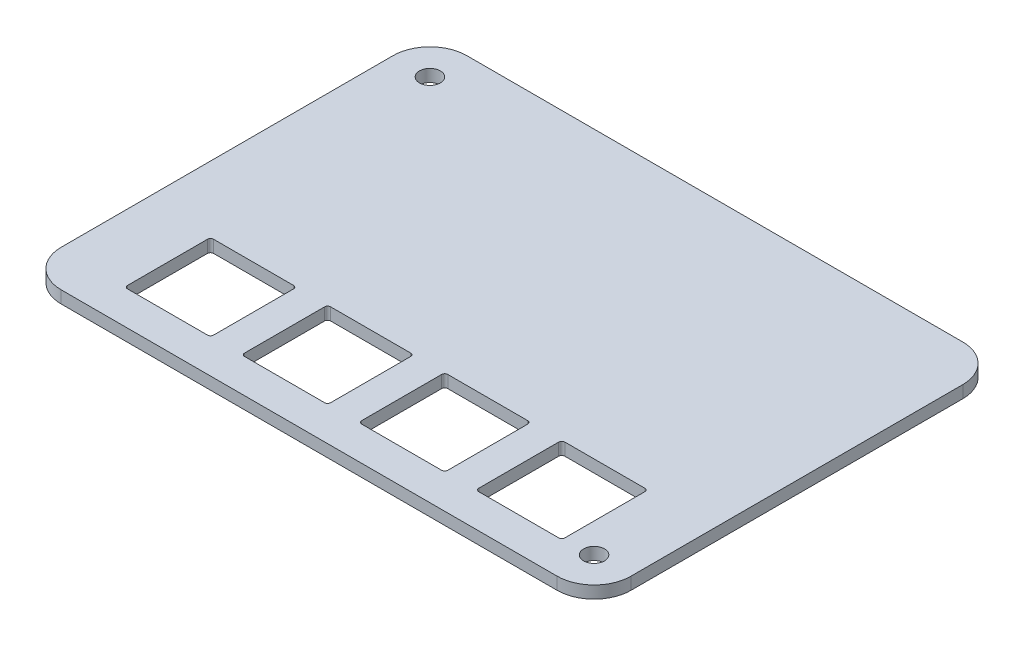
from build123d import *

# Parameters (mm, degrees)
SCHIZZO1_W                   = 92.702636
SCHIZZO1_H                   = 66
SCHIZZO1_W_2                 = 76.2
SCHIZZO1_H_2                 = 60
SCHIZZO1_H_3                 = 19.05
SCHIZZO1_H_4                 = 40.95
ESTRUSIONE_ESTRUSIONE1_DEPTH = 2
RACCORDO1_R                  = 6
FORO_PER_VITE_M3_1_D         = 3.4
FORO_PER_VITE_M3_1_DEPTH     = 13
FORO_PER_VITE_M3_1_TIP       = 1.021463052
TAGLIO_ESTRUSIONE1_DEPTH     = 1
ESTRUSIONE_ESTRUSIONE2_DEPTH = 1


with BuildPart() as part:
    # Schizzo1 → Estrusione-Estrusione1 (new body)
    # profile 1 of 3: a face of its own
    with BuildSketch(Plane(origin=(0, 0, 0), x_dir=(1, 0, 0), z_dir=(0, 1, 0))):
        with Locations((-38.1, 30)):
            Rectangle(SCHIZZO1_W, SCHIZZO1_H)
        with Locations((-38.1, 30)):
            Rectangle(SCHIZZO1_W_2, SCHIZZO1_H_2, mode=Mode.SUBTRACT)
    # profile 2 of 3: a face of its own
    with BuildSketch(Plane(origin=(0, 0, 0), x_dir=(1, 0, 0), z_dir=(0, 1, 0))):
        with Locations((-38.1, 9.525)):
            Rectangle(SCHIZZO1_W_2, SCHIZZO1_H_3)
        with BuildLine():
            ThreePointArc((-73.675, 16.025), (-73.528553391, 16.378553391), (-73.175, 16.525))
            Line((-73.175, 16.525), (-60.175, 16.525))
            ThreePointArc((-60.175, 16.525), (-59.821446609, 16.378553391), (-59.675, 16.025))
            Line((-59.675, 16.025), (-59.675, 3.025))
            ThreePointArc((-59.675, 3.025), (-59.821446609, 2.671446609), (-60.175, 2.525))
            Line((-60.175, 2.525), (-73.175, 2.525))
            ThreePointArc((-73.175, 2.525), (-73.528553391, 2.671446609), (-73.675, 3.025))
            Line((-73.675, 3.025), (-73.675, 16.025))
        make_face(mode=Mode.SUBTRACT)
        with BuildLine():
            ThreePointArc((-54.625, 16.025), (-54.478553391, 16.378553391), (-54.125, 16.525))
            Line((-54.125, 16.525), (-41.125, 16.525))
            ThreePointArc((-41.125, 16.525), (-40.771446609, 16.378553391), (-40.625, 16.025))
            Line((-40.625, 16.025), (-40.625, 3.025))
            ThreePointArc((-40.625, 3.025), (-40.771446609, 2.671446609), (-41.125, 2.525))
            Line((-41.125, 2.525), (-54.125, 2.525))
            ThreePointArc((-54.125, 2.525), (-54.478553391, 2.671446609), (-54.625, 3.025))
            Line((-54.625, 3.025), (-54.625, 16.025))
        make_face(mode=Mode.SUBTRACT)
        with BuildLine():
            ThreePointArc((-35.575, 16.025), (-35.428553391, 16.378553391), (-35.075, 16.525))
            Line((-35.075, 16.525), (-22.075, 16.525))
            ThreePointArc((-22.075, 16.525), (-21.721446609, 16.378553391), (-21.575, 16.025))
            Line((-21.575, 16.025), (-21.575, 3.025))
            ThreePointArc((-21.575, 3.025), (-21.721446609, 2.671446609), (-22.075, 2.525))
            Line((-22.075, 2.525), (-35.075, 2.525))
            ThreePointArc((-35.075, 2.525), (-35.428553391, 2.671446609), (-35.575, 3.025))
            Line((-35.575, 3.025), (-35.575, 16.025))
        make_face(mode=Mode.SUBTRACT)
        with BuildLine():
            ThreePointArc((-16.525, 16.025), (-16.378553391, 16.378553391), (-16.025, 16.525))
            Line((-16.025, 16.525), (-3.025, 16.525))
            ThreePointArc((-3.025, 16.525), (-2.671446609, 16.378553391), (-2.525, 16.025))
            Line((-2.525, 16.025), (-2.525, 3.025))
            ThreePointArc((-2.525, 3.025), (-2.671446609, 2.671446609), (-3.025, 2.525))
            Line((-3.025, 2.525), (-16.025, 2.525))
            ThreePointArc((-16.025, 2.525), (-16.378553391, 2.671446609), (-16.525, 3.025))
            Line((-16.525, 3.025), (-16.525, 16.025))
        make_face(mode=Mode.SUBTRACT)
    # profile 3 of 3: a face of its own
    with BuildSketch(Plane(origin=(0, 0, 0), x_dir=(1, 0, 0), z_dir=(0, 1, 0))):
        with Locations((-38.1, 39.525)):
            Rectangle(SCHIZZO1_W_2, SCHIZZO1_H_4)
    extrude(amount=ESTRUSIONE_ESTRUSIONE1_DEPTH)

    # Raccordo1
    raccordo1_edges = [part.edges().sort_by_distance(p)[0] for p in [
        (-84.451318, 1, -63),
        (8.251318, 1, -63),
        (8.251318, 1, 3),
        (-84.451318, 1, 3),
    ]]
    fillet(raccordo1_edges, radius=RACCORDO1_R)

    # Foro per Vite M3-1
    with Locations(Plane(origin=(0, 2, 0), x_dir=(1, 0, 0), z_dir=(0, 1, 0))):
        with Locations((-78.451318, 57), (2.251318, 3)):
            Hole(FORO_PER_VITE_M3_1_D / 2, depth=FORO_PER_VITE_M3_1_DEPTH)
            with Locations((0, 0, -(FORO_PER_VITE_M3_1_DEPTH + FORO_PER_VITE_M3_1_TIP / 2))):  # 118° drill point
                Cone(0, FORO_PER_VITE_M3_1_D / 2, FORO_PER_VITE_M3_1_TIP, mode=Mode.SUBTRACT)

    # Schizzo5 → Taglio-Estrusione1 (cut)
    with BuildSketch(Plane(origin=(0, 0, 0), x_dir=(1, 0, 0), z_dir=(0, 1, 0))):
        with BuildLine():
            Line((-46.671069795, 26.944756437), (-46.537736461, 27.320946913))
            Line((-46.537736461, 27.320946913), (-46.294879319, 27.697137389))
            Line((-46.294879319, 27.697137389), (-45.213926938, 29.611423104))
            Line((-45.213926938, 29.611423104), (-43.937736461, 31.763804056))
            Line((-43.937736461, 31.763804056), (-43.304403128, 32.701899294))
            Line((-43.304403128, 32.701899294), (-43.06630789, 33.07808977))
            Line((-43.06630789, 33.07808977), (-42.813926938, 33.659042151))
            Line((-42.813926938, 33.659042151), (-42.680593604, 34.292375485))
            Line((-42.680593604, 34.292375485), (-41.656784081, 37.768565961))
            Line((-41.656784081, 37.768565961), (-40.980593604, 39.739994532))
            Line((-40.980593604, 39.739994532), (-40.637736461, 40.88761358))
            Line((-40.637736461, 40.88761358), (-39.794879319, 43.611423104))
            Line((-39.794879319, 43.611423104), (-39.485355509, 43.782851675))
            add(Edge.make_bspline(
                [(-39.485355509, 43.782851675), (-38.952022176, 43.939994532), (-38.928212652, 43.939994532)],
                knots=[13, 13, 13, 14, 14, 14], degree=2))
            add(Edge.make_bspline(
                [(-38.928212652, 43.939994532), (-38.904403128, 43.939994532), (-38.123450747, 44.092375485)],
                knots=[14, 14, 14, 15, 15, 15], degree=2))
            Line((-38.123450747, 44.092375485), (-37.456784081, 44.206661199))
            add(Edge.make_bspline(
                [(-37.456784081, 44.206661199), (-36.690117414, 44.354280247), (-36.66630789, 44.354280247)],
                knots=[16, 16, 16, 17, 17, 17], degree=2))
            add(Edge.make_bspline(
                [(-36.66630789, 44.354280247), (-36.642498366, 44.354280247), (-36.137736461, 44.354280247)],
                knots=[17, 17, 17, 18, 18, 18], degree=2))
            Line((-36.137736461, 44.354280247), (-36.028212652, 44.316185008))
            Line((-36.028212652, 44.316185008), (-35.237736461, 41.239994532))
            Line((-35.237736461, 41.239994532), (-34.613926938, 39.030470723))
            Line((-34.613926938, 39.030470723), (-34.228212652, 38.059042151))
            Line((-34.228212652, 38.059042151), (-34.028212652, 37.444756437))
            Line((-34.028212652, 37.444756437), (-33.909165033, 36.982851675))
            Line((-33.909165033, 36.982851675), (-33.413926938, 35.773327866))
            Line((-33.413926938, 35.773327866), (-33.337736461, 35.320946913))
            Line((-33.337736461, 35.320946913), (-32.713926938, 33.944756437))
            Line((-32.713926938, 33.944756437), (-32.013926938, 32.573327866))
            Line((-32.013926938, 32.573327866), (-30.818688842, 30.225708818))
            Line((-30.818688842, 30.225708818), (-29.699641223, 27.916185008))
            Line((-29.699641223, 27.916185008), (-29.594879319, 27.592375485))
            Line((-29.594879319, 27.592375485), (-29.480593604, 27.506661199))
            Line((-29.480593604, 27.506661199), (-29.528212652, 27.330470723))
            Line((-29.528212652, 27.330470723), (-29.856784081, 26.859042151))
            add(Edge.make_bspline(
                [(-29.856784081, 26.859042151), (-29.942498366, 26.649518342), (-29.956784081, 26.654280247)],
                knots=[34, 34, 34, 35, 35, 35], degree=2))
            add(Edge.make_bspline(
                [(-29.956784081, 26.654280247), (-29.971069795, 26.659042151), (-30.461545985, 26.211423104)],
                knots=[35, 35, 35, 36, 36, 36], degree=2))
            Line((-30.461545985, 26.211423104), (-31.199641223, 25.673327866))
            Line((-31.199641223, 25.673327866), (-31.813926938, 25.292375485))
            Line((-31.813926938, 25.292375485), (-32.632974557, 24.844756437))
            Line((-32.632974557, 24.844756437), (-32.861545985, 24.749518342))
            add(Edge.make_bspline(
                [(-32.861545985, 24.749518342), (-34.032974557, 24.539994532), (-34.061545985, 24.549518342)],
                knots=[40, 40, 40, 41, 41, 41], degree=2))
            add(Edge.make_bspline(
                [(-34.061545985, 24.549518342), (-34.090117414, 24.559042151), (-35.494879319, 24.47808977)],
                knots=[41, 41, 41, 42, 42, 42], degree=2))
            Line((-35.494879319, 24.47808977), (-37.128212652, 24.58761358))
            Line((-37.128212652, 24.58761358), (-37.261545985, 24.706661199))
            Line((-37.261545985, 24.706661199), (-37.418688842, 27.725708818))
            Line((-37.418688842, 27.725708818), (-37.5758317, 29.725708818))
            Line((-37.5758317, 29.725708818), (-37.56630789, 31.368565961))
            Line((-37.56630789, 31.368565961), (-37.723450747, 32.573327866))
            Line((-37.723450747, 32.573327866), (-37.7758317, 32.944756437))
            Line((-37.7758317, 32.944756437), (-39.904403128, 32.973327866))
            Line((-39.904403128, 32.973327866), (-39.813926938, 32.263804056))
            Line((-39.813926938, 32.263804056), (-39.909165033, 31.244756437))
            Line((-39.909165033, 31.244756437), (-40.085355509, 30.706661199))
            Line((-40.085355509, 30.706661199), (-40.128212652, 29.906661199))
            Line((-40.128212652, 29.906661199), (-40.361545985, 28.754280247))
            Line((-40.361545985, 28.754280247), (-40.542498366, 27.625708818))
            Line((-40.542498366, 27.625708818), (-40.690117414, 26.244756437))
            Line((-40.690117414, 26.244756437), (-40.918688842, 24.820946913))
            Line((-40.918688842, 24.820946913), (-41.037736461, 24.459042151))
            Line((-41.037736461, 24.459042151), (-43.652022176, 24.063804056))
            Line((-43.652022176, 24.063804056), (-43.923450747, 24.206661199))
            add(Edge.make_bspline(
                [(-43.923450747, 24.206661199), (-44.785355509, 25.197137389), (-44.809165033, 25.206661199)],
                knots=[61, 61, 61, 62, 62, 62], degree=2))
            add(Edge.make_bspline(
                [(-44.809165033, 25.206661199), (-44.832974557, 25.216185008), (-46.056784081, 26.349518342), (-46.0758317, 26.359042151)],
                knots=[62, 62, 62, 62, 63, 63, 63, 63], degree=3))
            add(Edge.make_bspline(
                [(-46.0758317, 26.359042151), (-46.094879319, 26.368565961), (-46.671069795, 26.944756437)],
                knots=[63, 63, 63, 64, 64, 64], degree=2))
        make_face()
        with BuildLine():
            Line((-37.550434874, 35.290788183), (-38.052022176, 35.48761358))
            Line((-38.052022176, 35.48761358), (-39.017101541, 35.95745485))
            add(Edge.make_bspline(
                [(-39.017101541, 35.95745485), (-39.429799954, 36.160629453), (-39.442498366, 36.192375485)],
                knots=[2, 2, 2, 3, 3, 3], degree=2))
            add(Edge.make_bspline(
                [(-39.442498366, 36.192375485), (-39.455196779, 36.224121516), (-39.588530112, 36.414597707)],
                knots=[3, 3, 3, 4, 4, 4], degree=2))
            Line((-39.588530112, 36.414597707), (-38.674244398, 41.722534215))
            Line((-38.674244398, 41.722534215), (-38.579006303, 41.6082485))
            Line((-38.579006303, 41.6082485), (-38.337736461, 40.725708818))
            Line((-38.337736461, 40.725708818), (-38.191704715, 39.6082485))
            Line((-38.191704715, 39.6082485), (-37.550434874, 35.81777231))
            Line((-37.550434874, 35.81777231), (-37.461545985, 35.551105643))
            Line((-37.461545985, 35.551105643), (-37.518688842, 35.360629453))
            Line((-37.518688842, 35.360629453), (-37.550434874, 35.290788183))
        make_face(mode=Mode.SUBTRACT)
    extrude(amount=TAGLIO_ESTRUSIONE1_DEPTH, mode=Mode.SUBTRACT)

    # Schizzo5<3> → Estrusione-Estrusione2 (add)
    with BuildSketch(Plane(origin=(0, 0, 0), x_dir=(1, 0, 0), z_dir=(0, 1, 0))):
        with BuildLine():
            Line((-48.935355509, 27.180470723), (-52.299641223, 33.982851675))
            Line((-52.299641223, 33.982851675), (-53.1758317, 36.211423104))
            Line((-53.1758317, 36.211423104), (-53.1758317, 36.592375485))
            Line((-53.1758317, 36.592375485), (-52.261545985, 37.439994532))
            add(Edge.make_bspline(
                [(-52.261545985, 37.439994532), (-47.852022176, 41.47808977), (-47.804403128, 41.573327866)],
                knots=[4, 4, 4, 5, 5, 5], degree=2))
            add(Edge.make_bspline(
                [(-47.804403128, 41.573327866), (-47.756784081, 41.668565961), (-45.290117414, 43.668565961), (-45.232974557, 43.763804056)],
                knots=[5, 5, 5, 5, 6, 6, 6, 6], degree=3))
            add(Edge.make_bspline(
                [(-45.232974557, 43.763804056), (-45.1758317, 43.859042151), (-44.299641223, 44.668565961)],
                knots=[6, 6, 6, 7, 7, 7], degree=2))
            add(Edge.make_bspline(
                [(-44.299641223, 44.668565961), (-44.842498366, 45.811423104), (-44.890117414, 45.830470723)],
                knots=[7, 7, 7, 8, 8, 8], degree=2))
            add(Edge.make_bspline(
                [(-44.890117414, 45.830470723), (-44.937736461, 45.849518342), (-46.252022176, 47.754280247)],
                knots=[8, 8, 8, 9, 9, 9], degree=2))
            Line((-46.252022176, 47.754280247), (-48.623450747, 50.497137389))
            Line((-48.623450747, 50.497137389), (-49.556784081, 51.630470723))
            Line((-49.556784081, 51.630470723), (-49.842498366, 51.859042151))
            Line((-49.842498366, 51.859042151), (-49.918688842, 52.116185008))
            Line((-49.918688842, 52.116185008), (-49.299641223, 52.506661199))
            Line((-49.299641223, 52.506661199), (-47.718688842, 53.325708818))
            Line((-47.718688842, 53.325708818), (-46.013926938, 54.07808977))
            Line((-46.013926938, 54.07808977), (-45.594879319, 54.28761358))
            Line((-45.594879319, 54.28761358), (-45.252022176, 54.106661199))
            Line((-45.252022176, 54.106661199), (-45.385355509, 54.020946913))
            Line((-45.385355509, 54.020946913), (-46.756784081, 53.439994532))
            Line((-46.756784081, 53.439994532), (-48.16630789, 52.820946913))
            Line((-48.16630789, 52.820946913), (-48.356784081, 52.630470723))
            Line((-48.356784081, 52.630470723), (-48.871069795, 52.363804056))
            Line((-48.871069795, 52.363804056), (-48.871069795, 52.259042151))
            Line((-48.871069795, 52.259042151), (-48.232974557, 52.211423104))
            Line((-48.232974557, 52.211423104), (-46.76630789, 52.249518342))
            Line((-46.76630789, 52.249518342), (-44.890117414, 52.335232627))
            Line((-44.890117414, 52.335232627), (-43.528212652, 52.544756437))
            Line((-43.528212652, 52.544756437), (-43.356784081, 54.173327866))
            Line((-43.356784081, 54.173327866), (-42.985355509, 53.954280247))
            Line((-42.985355509, 53.954280247), (-43.147260271, 52.754280247))
            Line((-43.147260271, 52.754280247), (-43.080593604, 52.649518342))
            Line((-43.080593604, 52.649518342), (-41.785355509, 52.801899294))
            add(Edge.make_bspline(
                [(-41.785355509, 52.801899294), (-41.061545985, 53.011423104), (-41.032974557, 53.011423104)],
                knots=[33, 33, 33, 34, 34, 34], degree=2))
            add(Edge.make_bspline(
                [(-41.032974557, 53.011423104), (-41.004403128, 53.011423104), (-40.756784081, 52.992375485)],
                knots=[34, 34, 34, 35, 35, 35], degree=2))
            Line((-40.756784081, 52.992375485), (-39.147260271, 53.459042151))
            Line((-39.147260271, 53.459042151), (-38.090117414, 53.792375485))
            Line((-38.090117414, 53.792375485), (-37.699641223, 53.897137389))
            Line((-37.699641223, 53.897137389), (-36.356784081, 54.382851675))
            Line((-36.356784081, 54.382851675), (-35.023450747, 52.373327866))
            add(Edge.make_bspline(
                [(-35.023450747, 52.373327866), (-35.032974557, 53.649518342), (-35.052022176, 53.697137389)],
                knots=[40, 40, 40, 41, 41, 41], degree=2))
            add(Edge.make_bspline(
                [(-35.052022176, 53.697137389), (-35.071069795, 53.744756437), (-35.213926938, 54.582851675), (-35.213926938, 54.611423104)],
                knots=[41, 41, 41, 41, 42, 42, 42, 42], degree=3))
            add(Edge.make_bspline(
                [(-35.213926938, 54.611423104), (-35.213926938, 54.639994532), (-35.080593604, 54.954280247)],
                knots=[42, 42, 42, 43, 43, 43], degree=2))
            Line((-35.080593604, 54.954280247), (-34.432974557, 55.106661199))
            Line((-34.432974557, 55.106661199), (-32.880593604, 55.668565961))
            Line((-32.880593604, 55.668565961), (-31.652022176, 56.135232627))
            Line((-31.652022176, 56.135232627), (-31.061545985, 56.516185008))
            Line((-31.061545985, 56.516185008), (-30.052022176, 57.020946913))
            Line((-30.052022176, 57.020946913), (-29.518688842, 57.382851675))
            Line((-29.518688842, 57.382851675), (-29.556784081, 57.544756437))
            Line((-29.556784081, 57.544756437), (-29.794879319, 57.582851675))
            Line((-29.794879319, 57.582851675), (-31.9758317, 57.473327866))
            Line((-31.9758317, 57.473327866), (-33.513926938, 57.368565961))
            Line((-33.513926938, 57.368565961), (-34.718688842, 57.125708818))
            Line((-34.718688842, 57.125708818), (-35.713926938, 56.906661199))
            Line((-35.713926938, 56.906661199), (-36.732974557, 56.706661199))
            Line((-36.732974557, 56.706661199), (-38.671069795, 56.144756437))
            Line((-38.671069795, 56.144756437), (-39.109165033, 56.08761358))
            Line((-39.109165033, 56.08761358), (-39.928212652, 55.844756437))
            Line((-39.928212652, 55.844756437), (-40.161545985, 55.749518342))
            Line((-40.161545985, 55.749518342), (-41.242498366, 55.463804056))
            Line((-41.242498366, 55.463804056), (-42.452022176, 55.092375485))
            Line((-42.452022176, 55.092375485), (-42.461545985, 53.811423104))
            Line((-42.461545985, 53.811423104), (-42.528212652, 53.78761358))
            Line((-42.528212652, 53.78761358), (-42.709165033, 53.854280247))
            Line((-42.709165033, 53.854280247), (-42.737736461, 53.935232627))
            Line((-42.737736461, 53.935232627), (-42.723450747, 54.535232627))
            Line((-42.723450747, 54.535232627), (-42.832974557, 55.225708818))
            Line((-42.832974557, 55.225708818), (-42.552022176, 55.316185008))
            Line((-42.552022176, 55.316185008), (-42.171069795, 55.535232627))
            Line((-42.171069795, 55.535232627), (-41.918688842, 55.573327866))
            Line((-41.918688842, 55.573327866), (-41.461545985, 55.749518342))
            Line((-41.461545985, 55.749518342), (-41.161545985, 55.782851675))
            Line((-41.161545985, 55.782851675), (-38.280593604, 56.663804056))
            Line((-38.280593604, 56.663804056), (-35.947260271, 57.130470723))
            Line((-35.947260271, 57.130470723), (-33.247260271, 57.759042151))
            Line((-33.247260271, 57.759042151), (-30.723450747, 57.973327866))
            Line((-30.723450747, 57.973327866), (-30.090117414, 58.059042151))
            Line((-30.090117414, 58.059042151), (-28.818688842, 57.997137389))
            Line((-28.818688842, 57.997137389), (-28.656784081, 57.901899294))
            Line((-28.656784081, 57.901899294), (-28.7758317, 57.620946913))
            Line((-28.7758317, 57.620946913), (-28.804403128, 57.382851675))
            Line((-28.804403128, 57.382851675), (-29.099641223, 56.535232627))
            Line((-29.099641223, 56.535232627), (-29.542498366, 55.444756437))
            Line((-29.542498366, 55.444756437), (-29.86630789, 54.682851675))
            Line((-29.86630789, 54.682851675), (-30.147260271, 53.844756437))
            Line((-30.147260271, 53.844756437), (-30.518688842, 52.654280247))
            Line((-30.518688842, 52.654280247), (-30.890117414, 51.273327866))
            Line((-30.890117414, 51.273327866), (-31.085355509, 50.559042151))
            Line((-31.085355509, 50.559042151), (-31.256784081, 50.07808977))
            Line((-31.256784081, 50.07808977), (-31.309165033, 49.725708818))
            Line((-31.309165033, 49.725708818), (-31.537736461, 48.98761358))
            Line((-31.537736461, 48.98761358), (-31.76630789, 47.925708818))
            Line((-31.76630789, 47.925708818), (-32.013926938, 46.320946913))
            Line((-32.013926938, 46.320946913), (-31.904403128, 46.27808977))
            Line((-31.904403128, 46.27808977), (-30.452022176, 44.792375485))
            Line((-30.452022176, 44.792375485), (-29.313926938, 43.835232627))
            Line((-29.313926938, 43.835232627), (-27.461545985, 42.239994532))
            Line((-27.461545985, 42.239994532), (-24.742498366, 40.206661199))
            Line((-24.742498366, 40.206661199), (-22.652022176, 38.644756437))
            Line((-22.652022176, 38.644756437), (-22.594879319, 38.363804056))
            Line((-22.594879319, 38.363804056), (-22.694879319, 38.101899294))
            Line((-22.694879319, 38.101899294), (-22.928212652, 37.339994532))
            Line((-22.928212652, 37.339994532), (-23.099641223, 36.682851675))
            Line((-23.099641223, 36.682851675), (-23.185355509, 36.306661199))
            Line((-23.185355509, 36.306661199), (-23.380593604, 35.725708818))
            Line((-23.380593604, 35.725708818), (-23.671069795, 35.030470723))
            Line((-23.671069795, 35.030470723), (-24.256784081, 33.354280247))
            Line((-24.256784081, 33.354280247), (-24.480593604, 32.730470723))
            Line((-24.480593604, 32.730470723), (-24.747260271, 32.254280247))
            Line((-24.747260271, 32.254280247), (-25.109165033, 31.416185008))
            Line((-25.109165033, 31.416185008), (-25.6758317, 30.097137389))
            Line((-25.6758317, 30.097137389), (-26.656784081, 28.273327866))
            Line((-26.656784081, 28.273327866), (-27.313926938, 27.220946913))
            Line((-27.313926938, 27.220946913), (-27.561545985, 26.77808977))
            Line((-27.561545985, 26.77808977), (-28.228212652, 25.701899294))
            Line((-28.228212652, 25.701899294), (-28.399641223, 25.430470723))
            Line((-28.399641223, 25.430470723), (-28.618688842, 25.192375485))
            Line((-28.618688842, 25.192375485), (-29.137736461, 24.459042151))
            Line((-29.137736461, 24.459042151), (-29.813926938, 23.68761358))
            Line((-29.813926938, 23.68761358), (-30.56630789, 23.459042151))
            Line((-30.56630789, 23.459042151), (-32.880593604, 23.249518342))
            Line((-32.880593604, 23.249518342), (-36.118688842, 22.982851675))
            Line((-36.118688842, 22.982851675), (-37.756784081, 22.925708818))
            Line((-37.756784081, 22.925708818), (-43.323450747, 22.730470723))
            Line((-43.323450747, 22.730470723), (-45.499641223, 22.954280247))
            Line((-45.499641223, 22.954280247), (-45.923450747, 23.030470723))
            Line((-45.923450747, 23.030470723), (-46.173450747, 23.201899294))
            Line((-46.173450747, 23.201899294), (-46.999641223, 24.273327866))
            Line((-46.999641223, 24.273327866), (-47.747260271, 25.32808977))
            Line((-47.747260271, 25.32808977), (-48.437736461, 26.344756437))
            Line((-48.437736461, 26.344756437), (-48.935355509, 27.180470723))
        make_face()
        with BuildLine():
            Line((-46.671069795, 26.944756437), (-46.537736461, 27.320946913))
            Line((-46.537736461, 27.320946913), (-46.294879319, 27.697137389))
            Line((-46.294879319, 27.697137389), (-45.213926938, 29.611423104))
            Line((-45.213926938, 29.611423104), (-43.937736461, 31.763804056))
            Line((-43.937736461, 31.763804056), (-43.304403128, 32.701899294))
            Line((-43.304403128, 32.701899294), (-43.06630789, 33.07808977))
            Line((-43.06630789, 33.07808977), (-42.813926938, 33.659042151))
            Line((-42.813926938, 33.659042151), (-42.680593604, 34.292375485))
            Line((-42.680593604, 34.292375485), (-41.656784081, 37.768565961))
            Line((-41.656784081, 37.768565961), (-40.980593604, 39.739994532))
            Line((-40.980593604, 39.739994532), (-40.637736461, 40.88761358))
            Line((-40.637736461, 40.88761358), (-39.794879319, 43.611423104))
            Line((-39.794879319, 43.611423104), (-39.485355509, 43.782851675))
            add(Edge.make_bspline(
                [(-39.485355509, 43.782851675), (-38.952022176, 43.939994532), (-38.928212652, 43.939994532)],
                knots=[13, 13, 13, 14, 14, 14], degree=2))
            add(Edge.make_bspline(
                [(-38.928212652, 43.939994532), (-38.904403128, 43.939994532), (-38.123450747, 44.092375485)],
                knots=[14, 14, 14, 15, 15, 15], degree=2))
            Line((-38.123450747, 44.092375485), (-37.456784081, 44.206661199))
            add(Edge.make_bspline(
                [(-37.456784081, 44.206661199), (-36.690117414, 44.354280247), (-36.66630789, 44.354280247)],
                knots=[16, 16, 16, 17, 17, 17], degree=2))
            add(Edge.make_bspline(
                [(-36.66630789, 44.354280247), (-36.642498366, 44.354280247), (-36.137736461, 44.354280247)],
                knots=[17, 17, 17, 18, 18, 18], degree=2))
            Line((-36.137736461, 44.354280247), (-36.028212652, 44.316185008))
            Line((-36.028212652, 44.316185008), (-35.237736461, 41.239994532))
            Line((-35.237736461, 41.239994532), (-34.613926938, 39.030470723))
            Line((-34.613926938, 39.030470723), (-34.228212652, 38.059042151))
            Line((-34.228212652, 38.059042151), (-34.028212652, 37.444756437))
            Line((-34.028212652, 37.444756437), (-33.909165033, 36.982851675))
            Line((-33.909165033, 36.982851675), (-33.413926938, 35.773327866))
            Line((-33.413926938, 35.773327866), (-33.337736461, 35.320946913))
            Line((-33.337736461, 35.320946913), (-32.713926938, 33.944756437))
            Line((-32.713926938, 33.944756437), (-32.013926938, 32.573327866))
            Line((-32.013926938, 32.573327866), (-30.818688842, 30.225708818))
            Line((-30.818688842, 30.225708818), (-29.699641223, 27.916185008))
            Line((-29.699641223, 27.916185008), (-29.594879319, 27.592375485))
            Line((-29.594879319, 27.592375485), (-29.480593604, 27.506661199))
            Line((-29.480593604, 27.506661199), (-29.528212652, 27.330470723))
            Line((-29.528212652, 27.330470723), (-29.856784081, 26.859042151))
            add(Edge.make_bspline(
                [(-29.856784081, 26.859042151), (-29.942498366, 26.649518342), (-29.956784081, 26.654280247)],
                knots=[34, 34, 34, 35, 35, 35], degree=2))
            add(Edge.make_bspline(
                [(-29.956784081, 26.654280247), (-29.971069795, 26.659042151), (-30.461545985, 26.211423104)],
                knots=[35, 35, 35, 36, 36, 36], degree=2))
            Line((-30.461545985, 26.211423104), (-31.199641223, 25.673327866))
            Line((-31.199641223, 25.673327866), (-31.813926938, 25.292375485))
            Line((-31.813926938, 25.292375485), (-32.632974557, 24.844756437))
            Line((-32.632974557, 24.844756437), (-32.861545985, 24.749518342))
            add(Edge.make_bspline(
                [(-32.861545985, 24.749518342), (-34.032974557, 24.539994532), (-34.061545985, 24.549518342)],
                knots=[40, 40, 40, 41, 41, 41], degree=2))
            add(Edge.make_bspline(
                [(-34.061545985, 24.549518342), (-34.090117414, 24.559042151), (-35.494879319, 24.47808977)],
                knots=[41, 41, 41, 42, 42, 42], degree=2))
            Line((-35.494879319, 24.47808977), (-37.128212652, 24.58761358))
            Line((-37.128212652, 24.58761358), (-37.261545985, 24.706661199))
            Line((-37.261545985, 24.706661199), (-37.418688842, 27.725708818))
            Line((-37.418688842, 27.725708818), (-37.5758317, 29.725708818))
            Line((-37.5758317, 29.725708818), (-37.56630789, 31.368565961))
            Line((-37.56630789, 31.368565961), (-37.723450747, 32.573327866))
            Line((-37.723450747, 32.573327866), (-37.7758317, 32.944756437))
            Line((-37.7758317, 32.944756437), (-39.904403128, 32.973327866))
            Line((-39.904403128, 32.973327866), (-39.813926938, 32.263804056))
            Line((-39.813926938, 32.263804056), (-39.909165033, 31.244756437))
            Line((-39.909165033, 31.244756437), (-40.085355509, 30.706661199))
            Line((-40.085355509, 30.706661199), (-40.128212652, 29.906661199))
            Line((-40.128212652, 29.906661199), (-40.361545985, 28.754280247))
            Line((-40.361545985, 28.754280247), (-40.542498366, 27.625708818))
            Line((-40.542498366, 27.625708818), (-40.690117414, 26.244756437))
            Line((-40.690117414, 26.244756437), (-40.918688842, 24.820946913))
            Line((-40.918688842, 24.820946913), (-41.037736461, 24.459042151))
            Line((-41.037736461, 24.459042151), (-43.652022176, 24.063804056))
            Line((-43.652022176, 24.063804056), (-43.923450747, 24.206661199))
            add(Edge.make_bspline(
                [(-43.923450747, 24.206661199), (-44.785355509, 25.197137389), (-44.809165033, 25.206661199)],
                knots=[61, 61, 61, 62, 62, 62], degree=2))
            add(Edge.make_bspline(
                [(-44.809165033, 25.206661199), (-44.832974557, 25.216185008), (-46.056784081, 26.349518342), (-46.0758317, 26.359042151)],
                knots=[62, 62, 62, 62, 63, 63, 63, 63], degree=3))
            add(Edge.make_bspline(
                [(-46.0758317, 26.359042151), (-46.094879319, 26.368565961), (-46.671069795, 26.944756437)],
                knots=[63, 63, 63, 64, 64, 64], degree=2))
        make_face(mode=Mode.SUBTRACT)
    extrude(amount=-ESTRUSIONE_ESTRUSIONE2_DEPTH)


solid = part.part
